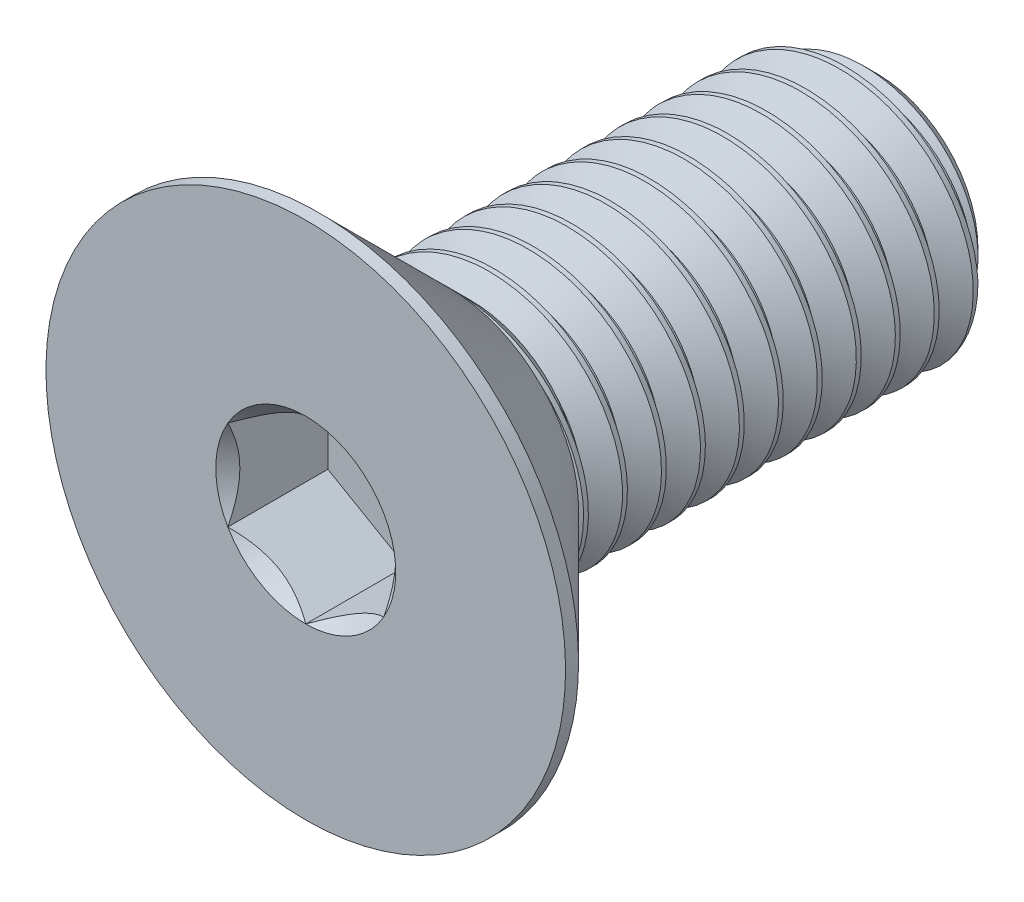
from build123d import *
from build123d.topology import SkipClean

# Parameters (mm, degrees)
SKETCH1_W          = 22
SKETCH1_H          = 5
CHAMFER1_SIZE      = 1.125
CUT_SWEEP1_PITCH   = 1.5
CUT_EXTRUDE2_DEPTH = 3.85


with BuildPart() as part:
    # Sketch1 → Revolve1 (revolve)
    with BuildSketch(Plane(origin=(0, 0, 0), x_dir=(0, 0, -1), z_dir=(1, 0, 0))):
        with Locations((11, 2.5)):
            Rectangle(SKETCH1_W, SKETCH1_H)
    revolve(axis=Axis((0, 0, -22), (0, 0, 1)))

    # Chamfer1
    chamfer1_edges = [part.edges().sort_by_distance(p)[0] for p in [
        (0, -5, -22),
    ]]
    chamfer(chamfer1_edges, length=CHAMFER1_SIZE)

    # Cut-Sweep1: arcs per turn and ends read off the stored shape
    # Cut-Sweep1: the profile of Sketch2 profile screwed along a right-hand helix through 16 turns, 8 arcs to a turn; built about Z, then put on its axis
    cut_sweep1_z = Axis((0, 0, 0), (0, 0, 1))
    cut_sweep1_corners = [(5.0003, 0, 0.000173205), (5.0003, 0, -1.312673205), (4.025721421, 0, -0.75), (4.025721421, 0, -0.5625)]
    with BuildLine(mode=Mode.PRIVATE) as cut_sweep1_profile:
        Line(cut_sweep1_corners[0], cut_sweep1_corners[1])
        Line(cut_sweep1_corners[1], cut_sweep1_corners[2])
        Line(cut_sweep1_corners[2], cut_sweep1_corners[3])
        Line(cut_sweep1_corners[3], cut_sweep1_corners[0])
    cut_sweep1_cap = Face(cut_sweep1_profile.wire())
    cut_sweep1_turn_angles = [0, 22.5, 45, 67.5, 90, 112.5, 135, 157.5, 180, 202.5, 225, 247.5, 270, 292.5, 315, 337.5, 360]
    cut_sweep1_turn_weights = [1, 0.9238795325112867, 1, 0.9238795325112867, 1, 0.9238795325112867, 1, 0.9238795325112867, 1, 0.9238795325112867, 1, 0.9238795325112867, 1, 0.9238795325112867, 1, 0.9238795325112867, 1]
    cut_sweep1_turn_rails = [Edge.make_bspline([Vector(p[0], p[1], 0).rotate(cut_sweep1_z, cut_sweep1_turn_angles[k]) / cut_sweep1_turn_weights[k] + Vector(0, 0, p[2] + CUT_SWEEP1_PITCH * cut_sweep1_turn_angles[k] / 360) for k in range(17)], [0, 0, 0, 1, 1, 2, 2, 3, 3, 4, 4, 5, 5, 6, 6, 7, 7, 8, 8, 8], 2, cut_sweep1_turn_weights) for p in cut_sweep1_corners]
    cut_sweep1_turn_sides = [Face.make_surface_from_curves(cut_sweep1_turn_rails[p[0]], cut_sweep1_turn_rails[p[1]]) for p in [(0, 1), (1, 2), (2, 3), (3, 0)]]
    cut_sweep1 = Plane(origin=(0, 0, -22), x_dir=(0, 1, 0), z_dir=(0, 0, 1)) * Solid(Shell([*[p.moved(Location((0, 0, CUT_SWEEP1_PITCH * i))) for i in range(16) for p in cut_sweep1_turn_sides], cut_sweep1_cap, cut_sweep1_cap.rotate(cut_sweep1_z, 5760).moved(Location((0, 0, CUT_SWEEP1_PITCH * 5760 / 360)))]))
    add(cut_sweep1, mode=Mode.SUBTRACT)

    # Sketch7 → Revolve2 (revolve)
    with BuildSketch(Plane(origin=(0, 0, 0), x_dir=(0, 0, -1), z_dir=(1, 0, 0)), mode=Mode.PRIVATE) as revolve2_sk:
        Polygon((0, 10), (0.5, 10), (5.5, 5), (5.5, 0), (0, 0), align=None)
    revolve(revolve2_sk.sketch.rotate(Axis((0, 0, 0), (0, 0, -1)), 189.052465709), axis=Axis((0, 0, 0), (0, 0, -1)))

    # Boss-Extrude1 cone 1 section (through the dimple's axis) → Boss-Extrude1 (revolve)
    with SkipClean():  # the faces are left unmerged after this step: merging them gives an invalid solid
        with BuildSketch(Plane(origin=(0, 0, -5.5), x_dir=(0, -1, 0), z_dir=(1, 0, 0))):
            Polygon((0, 0), (5, 0), (0, 5), align=None)
        revolve(axis=Axis((0, 0, -5.5), (0, 0, -1)))

    # Sketch5 → Cut-Extrude2 (cut)
    with SkipClean():  # the faces are left unmerged after this step: merging them gives an invalid solid
        with BuildSketch(Plane.XY):
            Polygon((3, -1.732050808), (3, 1.732050808), (0, 3.464101615), (-3, 1.732050808), (-3, -1.732050808), (0, -3.464101615), align=None)
        extrude(amount=-CUT_EXTRUDE2_DEPTH, mode=Mode.SUBTRACT)

    # Cut-Extrude3 cone 1 section (through the dimple's axis) → Cut-Extrude3 (revolve, cut)
    with SkipClean():  # the faces are left unmerged after this step: merging them gives an invalid solid
        with BuildSketch(Plane(origin=(0, 0, 0), x_dir=(0, -1, 0), z_dir=(1, 0, 0))):
            Polygon((0, 0), (3.464101615, 0), (0, 3.464101615), align=None)
        revolve(axis=Axis((0, 0, 0), (0, 0, -1)), mode=Mode.SUBTRACT)


solid = part.part
